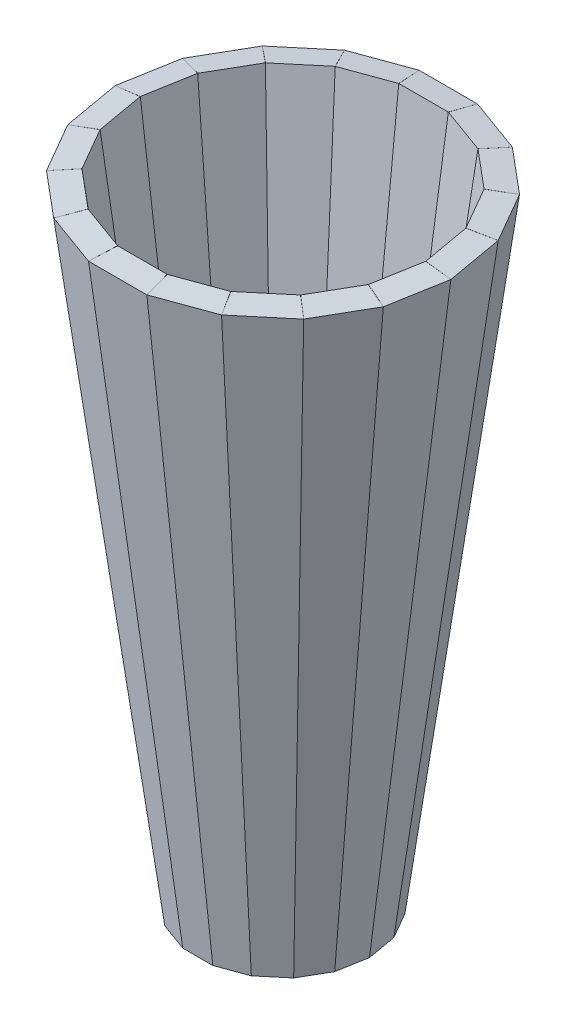
from build123d import *

# Parameters (mm, degrees)
LOFT1_DEPTH         = 508
LOFT1_TAPER         = -7.2718628
SHELL1_T            = -19.05
BOSS_EXTRUDE1_REACH = 556.314
CIRPATTERN2_COUNT   = 18
CUT_EXTRUDE1_DEPTH  = 520.365248901
CUT_EXTRUDE1_TAPER  = -4
CIRPATTERN3_COUNT   = 18


# Read off the part's stored shape, not the designer's step: Loft1
with BuildPart() as part:
    # Loft1 outline → Loft1 (new body)
    with BuildSketch(Plane(origin=(0, -508, 0), x_dir=(1, 0, 0), z_dir=(0, 1, 0))):
        Polygon((62.165927366, 0), (58.41686321, 21.261999388), (47.62186321, 39.959487855), (31.082963683, 53.837272348), (10.795, 61.221487243), (-10.795, 61.221487243), (-31.082963683, 53.837272348), (-47.62186321, 39.959487855), (-58.41686321, 21.261999388), (-62.165927366, 0), (-58.41686321, -21.261999388), (-47.62186321, -39.959487855), (-31.082963683, -53.837272348), (-10.795, -61.221487243), (10.795, -61.221487243), (31.082963683, -53.837272348), (47.62186321, -39.959487855), (58.41686321, -21.261999388), align=None)
    extrude(amount=LOFT1_DEPTH, taper=LOFT1_TAPER)

    # Shell1
    shell1_openings = [part.faces().sort_by_distance(p)[0] for p in [
        (0, -508, 0),
        (0, 0, 0),
    ]]
    offset(amount=SHELL1_T, openings=shell1_openings, kind=Kind.INTERSECTION)

    # Sketch4 → Boss-Extrude1 (add, up to next)
    with BuildSketch(Plane(origin=(1.988783013, 15.826037693, 0.350676104), x_dir=(0.17364817766693044, 0, -0.984807753012208), z_dir=(-0.12465449139647747, -0.9919567226287147, -0.02197995009969021)), mode=Mode.PRIVATE) as boss_extrude1_sk1:
        Polygon((22.225, 125.03042967), (-22.225, 125.03042967), (-18.838734344, 105.98042967), (18.838734344, 105.98042967), align=None)
    boss_extrude1_tool1 = extrude(boss_extrude1_sk1.sketch, amount=BOSS_EXTRUDE1_REACH, mode=Mode.PRIVATE) - part.part
    boss_extrude1 = boss_extrude1_tool1.solids().sort_by_distance((115.080268, 1.17251, 20.291756))[0]
    add(boss_extrude1)

    # CirPattern2: Boss-Extrude1 ×18 about axis
    cirpattern2_axis = Axis((0, 0, 0), (0, 1, 0))
    for i in range(1, CIRPATTERN2_COUNT):
        add(boss_extrude1.rotate(cirpattern2_axis, i * 360 / CIRPATTERN2_COUNT))

    # Sketch6 → Cut-Extrude1 (cut, through all)
    with BuildSketch(Plane(origin=(-58.169474535, -462.892276648, -10.256847814), x_dir=(0.17364817766693008, -4.721783215807671e-15, -0.9848077530122081), z_dir=(-0.1246544913964783, -0.9919567226287147, -0.02197995009968555))):
        Polygon((-6.626050911, 96.634623737), (6.639444595, 96.634623737), (12.756254558, 132.811711406), (-12.8395365, 132.811711406), align=None)
    cut_extrude1 = extrude(amount=CUT_EXTRUDE1_DEPTH, taper=CUT_EXTRUDE1_TAPER, mode=Mode.SUBTRACT)

    # CirPattern3: Cut-Extrude1 ×18 about axis
    cirpattern3_axis = Axis((0, 0, 0), (0, 1, 0))
    for i in range(1, CIRPATTERN3_COUNT):
        add(cut_extrude1.rotate(cirpattern3_axis, i * 360 / CIRPATTERN3_COUNT), mode=Mode.SUBTRACT)


solid = part.part
